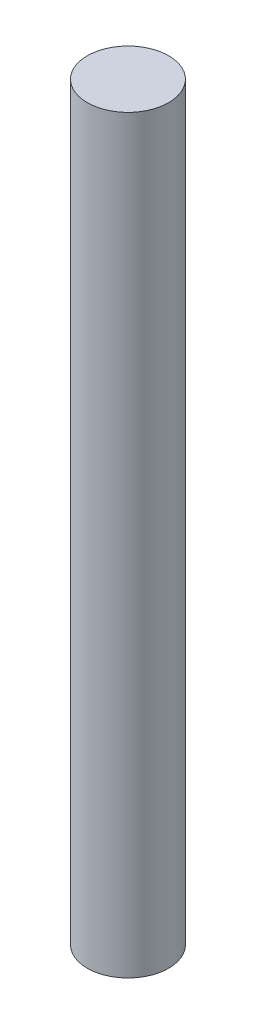
from build123d import *

# Parameters (mm, degrees)
SKETCH1_R           = 0.5
BOSS_EXTRUDE1_DEPTH = 9.22


with BuildPart() as part:
    # Sketch1 → Boss-Extrude1 (new body)
    with BuildSketch(Plane(origin=(0, 0, 0), x_dir=(1, 0, 0), z_dir=(0, 1, 0))):
        Circle(SKETCH1_R)
    extrude(amount=BOSS_EXTRUDE1_DEPTH)


solid = part.part
